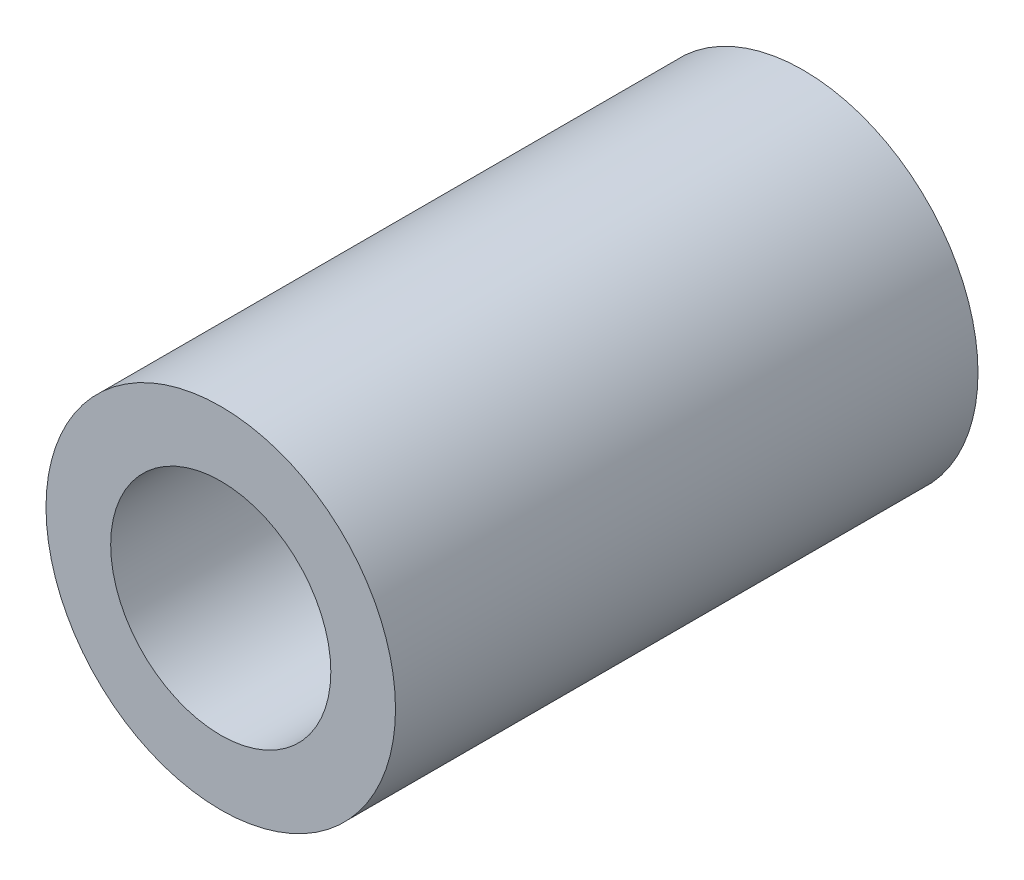
from build123d import *

# Parameters (mm, degrees)
SKETCH1_R           = 2.38125
SKETCH1_R_2         = 1.5
BOSS_EXTRUDE1_DEPTH = 3.96875


with BuildPart() as part:
    # Sketch1 → Boss-Extrude1 (new, symmetric)
    with BuildSketch(Plane.XY):
        Circle(SKETCH1_R)
        Circle(SKETCH1_R_2, mode=Mode.SUBTRACT)
    extrude(amount=BOSS_EXTRUDE1_DEPTH, both=True)


solid = part.part
